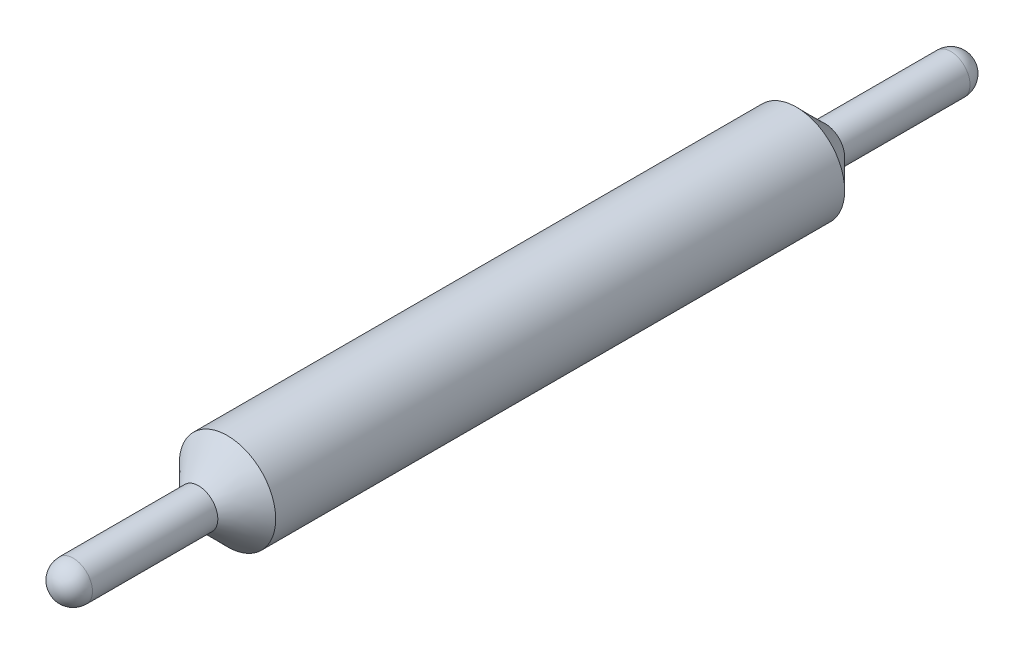
from build123d import *

# Parameters (mm, degrees)
CROQUIS1_R              = 0.25
SALIENTE_EXTRUIR1_DEPTH = 3.25
CROQUIS2_R              = 0.1
SALIENTE_EXTRUIR2_DEPTH = 0.65
SALIENTE_EXTRUIR3_START = 0.65
CROQUIS3_R              = 0.1
SALIENTE_EXTRUIR3_DEPTH = 0.65
C_PULA1_FACE_RADIUS     = 0.1
C_PULA1_HEIGHT          = 0.1
CHAFL_N2_SIZE           = 0.15


# Read off the part's stored shape, not the designer's step: Cúpula2
with BuildPart() as part:
    # Croquis1 → Saliente-Extruir1 (new body)
    with BuildSketch(Plane.XY):
        Circle(CROQUIS1_R)
    extrude(amount=SALIENTE_EXTRUIR1_DEPTH)

    # Croquis2 → Saliente-Extruir2 (add)
    with BuildSketch(Plane(origin=(0, 0, 0), x_dir=(-1, 0, 0), z_dir=(0, 0, -1))):
        with Locations(Location((0, 0, 0), (0, 0, 180))):
            Circle(CROQUIS2_R)
    extrude(amount=SALIENTE_EXTRUIR2_DEPTH)

    # Croquis3 → Saliente-Extruir3 (add)
    with BuildSketch(Plane.XY.offset(3.25).offset(SALIENTE_EXTRUIR3_START)):
        Circle(CROQUIS3_R)
    extrude(amount=-SALIENTE_EXTRUIR3_DEPTH)

    # Cúpula1: an elliptical dome of height H over a round flat face of radius A is half a spheroid: the quarter ellipse of half axes A and H revolved about the face's axis
    with BuildSketch(Plane((0, 0, -0.65), x_dir=(0, -1, 0), z_dir=(1, 0, 0)), mode=Mode.PRIVATE) as c_pula1_quarter:
        Ellipse(C_PULA1_FACE_RADIUS, C_PULA1_HEIGHT)
        Rectangle(C_PULA1_FACE_RADIUS, C_PULA1_HEIGHT, align=(Align.MIN, Align.MIN), mode=Mode.INTERSECT)
    revolve(c_pula1_quarter.sketch, axis=Axis((0, 0, -0.65), (0, 0, -1)))

    # Cúpula2 outline → Cúpula2 (revolve)
    with BuildSketch(Plane.XZ):
        with BuildLine():
            Line((0, 3.9), (0.1, 3.9))
            ThreePointArc((0.1, 3.9), (0.070710678, 3.970710678), (0, 4))
            Line((0, 4), (0, 3.9))
        make_face()
    revolve(axis=Axis((0, 0, 0), (0, 0, 1)))

    # Chaflán2
    chafl_n2_edges = [part.edges().sort_by_distance(p)[0] for p in [
        (-0.25, 0, 0),
        (-0.25, 0, 3.25),
    ]]
    chamfer(chafl_n2_edges, length=CHAFL_N2_SIZE - 0.0001)  # a hair under: the kernel refuses the full size


solid = part.part
